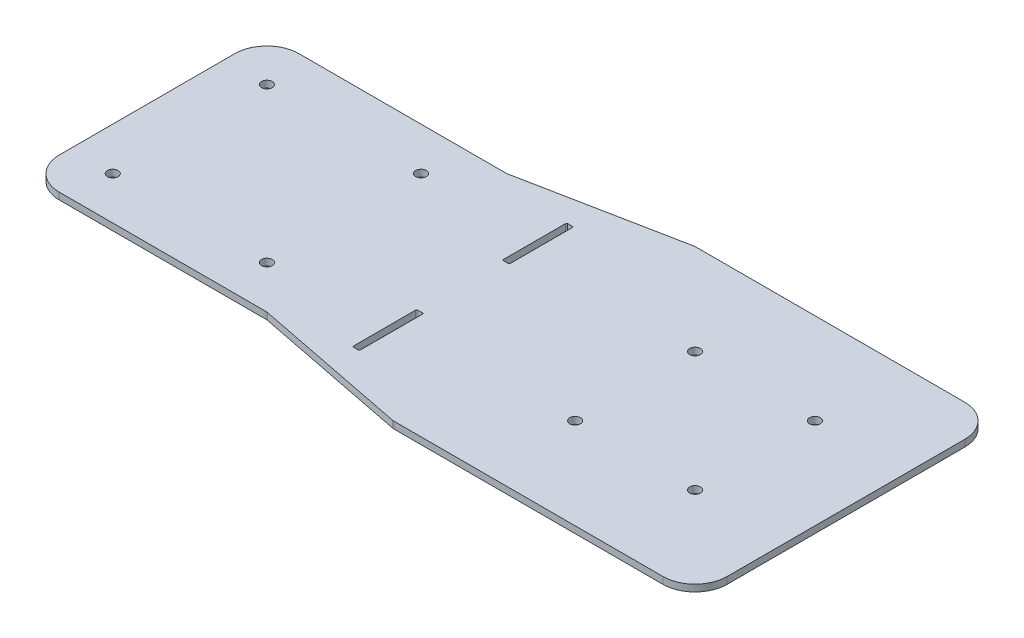
from build123d import *

# Parameters (mm, degrees)
BOSS_EXTRUDE1_DEPTH = 3.175
SKETCH5_R           = 2.5
CUT_EXTRUDE2_DEPTH  = 280.554253455
CUT_EXTRUDE3_DEPTH  = 280.554253455
FILLET1_R           = 15
FILLET2_R           = 5
SKETCH7_R           = 2.5
CUT_EXTRUDE4_DEPTH  = 280.554253455


with BuildPart() as part:
    # Sketch1 → Boss-Extrude1 (new body)
    with BuildSketch(Plane(origin=(0, 0, 0), x_dir=(1, 0, 0), z_dir=(0, 1, 0))):
        Polygon((56, 56), (129.5, 70.5), (270.5, 70.5), (270.5, -70.5), (129.5, -70.5), (56, -56), (-56, -56), (-56, 56), align=None)
    extrude(amount=BOSS_EXTRUDE1_DEPTH)

    # Sketch5 → Cut-Extrude2 (cut, through all)
    with BuildSketch(Plane(origin=(0, 3.175, 0), x_dir=(1, 0, 0), z_dir=(0, 1, 0))):
        with Locations((172, 28)):
            Circle(SKETCH5_R)
        with Locations((228, 28)):
            Circle(SKETCH5_R)
        with Locations((228, -28)):
            Circle(SKETCH5_R)
        with Locations((172, -28)):
            Circle(SKETCH5_R)
    extrude(amount=-CUT_EXTRUDE2_DEPTH, mode=Mode.SUBTRACT)

    # Sketch6 → Cut-Extrude3 (cut, through all)
    with BuildSketch(Plane(origin=(0, 3.175, 0), x_dir=(1, 0, 0), z_dir=(0, 1, 0))):
        with BuildLine():
            Line((93.2, 20.5), (93.2, 49.5))
            ThreePointArc((93.2, 49.5), (93.053553391, 49.853553391), (92.7, 50))
            Line((92.7, 50), (90.5, 50))
            ThreePointArc((90.5, 50), (90.146446609, 49.853553391), (90, 49.5))
            Line((90, 49.5), (90, 20.5))
            ThreePointArc((90, 20.5), (90.146446609, 20.146446609), (90.5, 20))
            Line((90.5, 20), (92.7, 20))
            ThreePointArc((92.7, 20), (93.053553391, 20.146446609), (93.2, 20.5))
        make_face()
        with BuildLine():
            Line((90.5, -20), (92.7, -20))
            ThreePointArc((92.7, -20), (93.053553391, -20.146446609), (93.2, -20.5))
            Line((93.2, -20.5), (93.2, -49.5))
            ThreePointArc((93.2, -49.5), (93.053553391, -49.853553391), (92.7, -50))
            Line((92.7, -50), (90.5, -50))
            ThreePointArc((90.5, -50), (90.146446609, -49.853553391), (90, -49.5))
            Line((90, -49.5), (90, -20.5))
            ThreePointArc((90, -20.5), (90.146446609, -20.146446609), (90.5, -20))
        make_face()
    extrude(amount=-CUT_EXTRUDE3_DEPTH, mode=Mode.SUBTRACT)

    # Fillet1
    fillet1_edges = [part.edges().sort_by_distance(p)[0] for p in [
        (-56, 1.5875, 56),
        (-56, 1.5875, -56),
        (270.5, 1.5875, -70.5),
        (270.5, 1.5875, 70.5),
    ]]
    fillet(fillet1_edges, radius=FILLET1_R)

    # Fillet2
    fillet2_edges = [part.edges().sort_by_distance(p)[0] for p in [
        (129.5, 1.5875, 70.5),
        (56, 1.5875, 56),
        (129.5, 1.5875, -70.5),
        (56, 1.5875, -56),
    ]]
    fillet(fillet2_edges, radius=FILLET2_R)

    # Sketch7 → Cut-Extrude4 (cut, through all)
    with BuildSketch(Plane(origin=(0, 3.175, 0), x_dir=(1, 0, 0), z_dir=(0, 1, 0))):
        with Locations((-36, 36)):
            Circle(SKETCH7_R)
        with Locations((36, 36)):
            Circle(SKETCH7_R)
        with Locations((-36, -36)):
            Circle(SKETCH7_R)
        with Locations((36, -36)):
            Circle(SKETCH7_R)
    extrude(amount=-CUT_EXTRUDE4_DEPTH, mode=Mode.SUBTRACT)


solid = part.part
